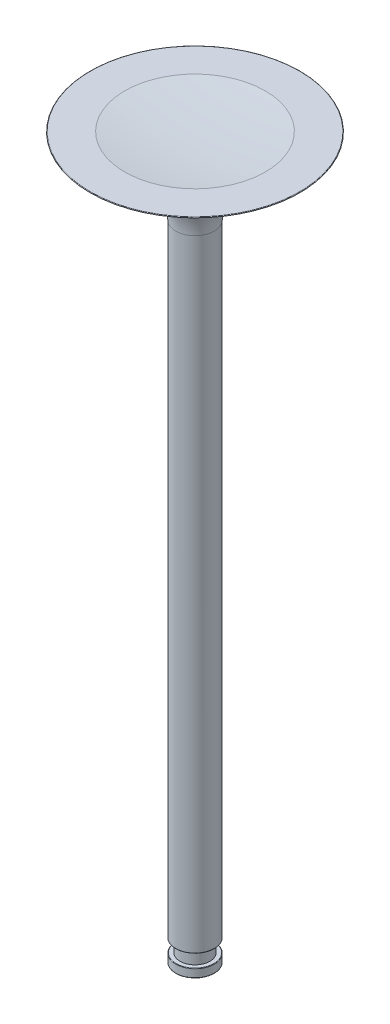
from build123d import *

# Parameters (mm, degrees)
FILLET1_R = 0.05


# Read off the part's stored shape, not the designer's step: Dome1
with BuildPart() as part:
    # Sketch1 → Revolve1 (revolve)
    with BuildSketch(Plane.XY, mode=Mode.PRIVATE) as revolve1_sk:
        with BuildLine():
            Line((0, 0), (0, 84.074))
            Line((0, 84.074), (-12.5, 84.074))
            ThreePointArc((-12.5, 84.074), (-10.551612699, 83.439395634), (-8.564414173, 82.939417836))
            ThreePointArc((-8.564414173, 82.939417836), (-4.025665232, 80.144708235), (-2.25, 75.119008613))
            Line((-2.25, 75.119008613), (-2.25, 2.5))
            Line((-2.25, 2.5), (-1.75, 2.5))
            Line((-1.75, 2.5), (-1.75, 1))
            Line((-1.75, 1), (-2.25, 1))
            Line((-2.25, 1), (-2.25, 0))
            Line((-2.25, 0), (0, 0))
        make_face()
    revolve(revolve1_sk.sketch.rotate(Axis((0, 0, 0), (0, 1, 0)), 270), axis=Axis((0, 0, 0), (0, 1, 0)))

    # Fillet1
    fillet1_edges = [part.edges().sort_by_distance(p)[0] for p in [
        (0, 84.074, 12.5),
        (0, 0, 2.25),
        (0, 1, 2.25),
        (0, 2.5, 2.25),
    ]]
    fillet(fillet1_edges, radius=FILLET1_R)

    # Dome1 outline → Dome1 (revolve, cut)
    with BuildSketch(Plane.XY):
        with BuildLine():
            Line((0, 84.074000008), (0, 83.574))
            ThreePointArc((0, 83.574), (4.113803997, 83.699115626), (8.21240119, 84.074000008))
            Line((8.21240119, 84.074000008), (0, 84.074000008))
        make_face()
    revolve(axis=Axis((0, 0, 0), (0, 1, 0)), mode=Mode.SUBTRACT)


solid = part.part
